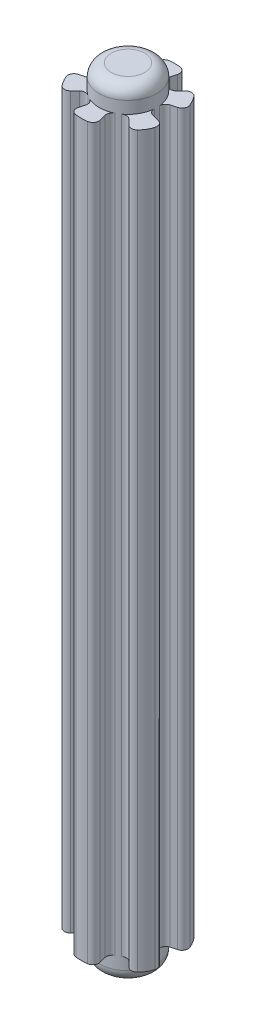
from build123d import *
from build123d.topology import SkipClean

# Parameters (mm, degrees)
BOSS_EXTRUDE1_DEPTH = 60
SKETCH4_R           = 2.375
BOSS_EXTRUDE3_DEPTH = 2
FILLET1_R           = 0.5
BOSS_EXTRUDE5_START = 2
SKETCH6_R           = 2.375
BOSS_EXTRUDE5_DEPTH = 2
FILLET2_R           = 1


with BuildPart() as part:
    # Sketch2 → Boss-Extrude1 (new body)
    with BuildSketch(Plane(origin=(0, 0, 0), x_dir=(1, 0, 0), z_dir=(0, 1, 0))):
        with BuildLine():
            Line((3.775215965, -0.978645895), (2.300774305, -0.58912019))
            ThreePointArc((2.300774305, -0.58912019), (2.374963211, 0.013219106), (2.294073837, 0.614695232))
            Line((2.294073837, 0.614695232), (3.742962577, 1.0029238))
            ThreePointArc((3.742962577, 1.0029238), (3.356294138, 1.936727823), (2.741299364, 2.73877761))
            Line((2.741299364, 2.73877761), (1.680151223, 1.678605632))
            ThreePointArc((1.680151223, 1.678605632), (1.187973207, 2.056537055), (0.614695232, 2.294073837))
            Line((0.614695232, 2.294073837), (1.0029238, 3.742962577))
            ThreePointArc((1.0029238, 3.742962577), (0, 3.875), (-1.0029238, 3.742962577))
            Line((-1.0029238, 3.742962577), (-0.614695232, 2.294073837))
            ThreePointArc((-0.614695232, 2.294073837), (-1.1875, 2.056810334), (-1.679378605, 1.679378605))
            Line((-1.679378605, 1.679378605), (-2.740038777, 2.740038777))
            ThreePointArc((-2.740038777, 2.740038777), (-3.35584844, 1.9375), (-3.742962577, 1.0029238))
            Line((-3.742962577, 1.0029238), (-2.294073837, 0.614695232))
            ThreePointArc((-2.294073837, 0.614695232), (-2.375, 0), (-2.294073837, -0.614695232))
            Line((-2.294073837, -0.614695232), (-3.742962577, -1.0029238))
            ThreePointArc((-3.742962577, -1.0029238), (-3.35584844, -1.9375), (-2.740038777, -2.740038777))
            Line((-2.740038777, -2.740038777), (-1.679378605, -1.679378605))
            ThreePointArc((-1.679378605, -1.679378605), (-1.1875, -2.056810334), (-0.614695232, -2.294073837))
            Line((-0.614695232, -2.294073837), (-1.0029238, -3.742962577))
            ThreePointArc((-1.0029238, -3.742962577), (0.033967076, -3.874851125), (1.068386506, -3.724805401))
            Line((1.068386506, -3.724805401), (0.681359786, -2.275164575))
            ThreePointArc((0.681359786, -2.275164575), (1.238849907, -2.026296106), (1.714477211, -1.643530618))
            Line((1.714477211, -1.643530618), (2.767163136, -2.698133353))
            ThreePointArc((2.767163136, -2.698133353), (3.500652231, -1.972912562), (3.775215965, -0.978645895))
        make_face()
        Polygon((0.085836926, -0.044584082), (0, 0), (0.073933818, 0), (0.104207494, -0.030328801), (0.080162685, -0.023330742), align=None, mode=Mode.SUBTRACT)
    extrude(amount=BOSS_EXTRUDE1_DEPTH)

    # Sketch4 → Boss-Extrude3 (add)
    with BuildSketch(Plane(origin=(0, 60, 0), x_dir=(1, 0, 0), z_dir=(0, 1, 0))):
        with Locations(Location((0, 0, 0), (0, 0, 75))):
            Circle(SKETCH4_R)
    extrude(amount=BOSS_EXTRUDE3_DEPTH)

    # Fillet1
    # the kernel refuses this fillet: 0.5 mm, written as the material it adds along each edge
    with BuildSketch(Plane(origin=(-2.294073837, 0, 0.614695232), x_dir=(-0.1735157400494046, 0, -0.9848310961556339), z_dir=(0, 1, 0)), Plane(origin=(-1.679378605, 0, -1.679378605), x_dir=(0.7661308776829403, 0, -0.6426845869170722), z_dir=(0, 1, 0)), Plane(origin=(0.614695232, 0, -2.294073837), x_dir=(0.939646617732385, 0, 0.3421465092384974), z_dir=(0, 1, 0)), Plane(origin=(2.294073837, 0, -0.614695232), x_dir=(0.1735157400495284, 0, 0.9848310961556122), z_dir=(0, 1, 0)), Plane(origin=(-0.614695232, 0, 2.294073837), x_dir=(-0.9396466177323688, 0, -0.3421465092385419), z_dir=(0, 1, 0))) as fillet1_piece_1:
        with BuildLine():
            CenterArc((0.458270974, 0.498091484), FILLET1_R, 185.007705084, 79.984589832)
            Line((-0.03982051, 0.45444663), (0, 0))
            ThreePointArc((0, 0), (0.20731306, 0.00906545), (0.414626119, 0))
        make_face()
    extrude(amount=60)
    with BuildSketch(Plane(origin=(-2.294073837, 0, -0.614695232), x_dir=(-0.17351574004940104, 0, 0.9848310961556345), z_dir=(0, 1, 0)), Plane(origin=(-0.614695232, 0, -2.294073837), x_dir=(-0.9396466177323672, 0, 0.3421465092385461), z_dir=(0, 1, 0)), Plane(origin=(1.680151223, 0, -1.678605632), x_dir=(-0.7658350540129166, 0, -0.643037067395833), z_dir=(0, 1, 0))) as fillet1_piece_2:
        with BuildLine():
            CenterArc((0.458270974, -0.498091484), FILLET1_R, 95.007705084, 79.984589832)
            Line((-0.03982051, -0.45444663), (0, 0))
            ThreePointArc((0, 0), (0.20731306, -0.00906545), (0.414626119, 0))
        make_face()
    extrude(amount=60)
    with BuildSketch(Plane(origin=(2.300774305, 0, 0.58912019), x_dir=(0.9668296370387235, 0, 0.2554221073900419), z_dir=(0, 1, 0))) as fillet1_piece_3:
        with BuildLine():
            CenterArc((0.453002414, 0.5), FILLET1_R, 190.38170854, 79.61829146)
            ThreePointArc((-0.038812111, 0.409897433), (-0.010506812, 0.205791362), (0, 0))
            Line((0, 0), (0.453002414, 0))
        make_face()
    extrude(amount=60)
    with BuildSketch(Plane(origin=(1.714477211, 0, 1.643530618), x_dir=(0.7064632978713469, 0, 0.7077496794494086), z_dir=(0, 1, 0))) as fillet1_piece_4:
        with BuildLine():
            CenterArc((0.465508471, -0.5), FILLET1_R, 90, 81.041880237)
            ThreePointArc((-0.02839274, -0.422143763), (-0.00477723, -0.211705398), (0, 0))
            Line((0, 0), (0.465508471, 0))
        make_face()
    extrude(amount=60)
    with BuildSketch(Plane(origin=(0.681359786, 0, 2.275164575), x_dir=(0.25794627414893684, 0, 0.966159262053975), z_dir=(0, 1, 0))) as fillet1_piece_5:
        with BuildLine():
            CenterArc((0.443713653, 0.5), FILLET1_R, 191.464392376, 78.535607624)
            ThreePointArc((-0.046310555, 0.400620549), (-0.014636445, 0.201295026), (0, 0))
            Line((0, 0), (0.443713653, 0))
        make_face()
    extrude(amount=60)
    with BuildSketch(Plane(origin=(-1.679378605, 0, 1.679378605), x_dir=(-0.7071067811865471, 0, 0.707106781186548), z_dir=(0, 1, 0))) as fillet1_piece_6:
        with BuildLine():
            CenterArc((0.456187913, 0.5), FILLET1_R, 190.015410168, 79.984589832)
            ThreePointArc((-0.036192593, 0.413043478), (-0.00906545, 0.20731306), (0, 0))
            Line((0, 0), (0.456187913, 0))
        make_face()
    extrude(amount=60)
    # the kernel refuses this fillet: 0.5 mm, written as the material it takes off along each edge
    with BuildSketch(Plane(origin=(-2.740038777, -1.439160897, 2.740038777), x_dir=(-0.6526300069150477, 0, -0.7576767609436524), z_dir=(0, 1, 0)), Plane(origin=(-3.742962577, -1.439160897, -1.0029238), x_dir=(0.3298523193767966, 0, -0.9440325457322686), z_dir=(0, 1, 0)), Plane(origin=(2.741299364, -1.439160897, -2.73877761), x_dir=(0.652281279601926, 0, 0.7579769998363237), z_dir=(0, 1, 0))) as fillet1_2_piece_1:
        with BuildLine():
            CenterArc((0.538524723, -0.49861874), FILLET1_R, 85.740187873, 98.519624254)
            Line((0.039905983, -0.535758376), (0, 0))
            ThreePointArc((0, 0), (0.287832179, 0.010704768), (0.575664359, 0))
        make_face()
    extrude(amount=62.878321794, mode=Mode.SUBTRACT)
    with BuildSketch(Plane(origin=(-3.742962577, -1.439160897, 1.0029238), x_dir=(0.9659258262890679, 0, -0.2588190451025218), z_dir=(0, 1, 0)), Plane(origin=(-2.740038777, -1.439160897, -2.740038777), x_dir=(0.7071067811865476, 0, 0.7071067811865476), z_dir=(0, 1, 0)), Plane(origin=(3.742962577, -1.439160897, -1.0029238), x_dir=(-0.9659258262890681, 0, 0.25881904510252185), z_dir=(0, 1, 0)), Plane(origin=(-1.0029238, -1.439160897, 3.742962577), x_dir=(0.2588190451025216, 0, -0.9659258262890681), z_dir=(0, 1, 0))) as fillet1_2_piece_2:
        with BuildLine():
            CenterArc((0.537242519, -0.5), FILLET1_R, 90, 98.519624254)
            ThreePointArc((0.04275993, -0.574074074), (0.010704768, -0.287832179), (0, 0))
            Line((0, 0), (0.537242519, 0))
        make_face()
    extrude(amount=62.878321794, mode=Mode.SUBTRACT)
    with BuildSketch(Plane(origin=(-1.0029238, -1.439160897, -3.742962577), x_dir=(0.25881904510252174, 0, 0.965925826289068), z_dir=(0, 1, 0))) as fillet1_2_piece_3:
        with BuildLine():
            CenterArc((0.537242519, 0.5), FILLET1_R, 171.480375746, 98.519624254)
            ThreePointArc((0.04275993, 0.574074074), (0.010704768, 0.287832179), (0, 0))
            Line((0, 0), (0.537242519, 0))
        make_face()
    extrude(amount=62.878321794, mode=Mode.SUBTRACT)
    with BuildSketch(Plane(origin=(1.0029238, -1.439160897, -3.742962577), x_dir=(-0.9824823262918377, 0, -0.1863557847886099), z_dir=(0, 1, 0))) as fillet1_2_piece_4:
        with BuildLine():
            CenterArc((0.538524723, 0.49861874), FILLET1_R, 175.740187873, 98.519624254)
            Line((0.039905983, 0.535758376), (0, 0))
            ThreePointArc((0, 0), (0.287832179, -0.010704768), (0.575664359, 0))
        make_face()
    extrude(amount=62.878321794, mode=Mode.SUBTRACT)
    with BuildSketch(Plane(origin=(3.775215965, -1.264396568, 0.978645895), x_dir=(-0.9668296370387236, 0, -0.25542210739004173), z_dir=(0, 1, 0))) as fillet1_2_piece_5:
        with BuildLine():
            CenterArc((0.437999819, 0.5), FILLET1_R, 179.77718135, 90.22281865)
            ThreePointArc((-0.0619964, 0.501944455), (-0.046928547, 0.249004631), (0, 0))
            Line((0, 0), (0.437999819, 0))
        make_face()
    extrude(amount=62.528793137, mode=Mode.SUBTRACT)
    with BuildSketch(Plane(origin=(2.767163136, -1.241563867, 2.698133353), x_dir=(0.8000663385432955, 0, -0.5999115384203949), z_dir=(0, 1, 0))) as fillet1_2_piece_6:
        with BuildLine():
            CenterArc((0.434547354, 0.496131331), FILLET1_R, 188.084320914, 89.047719887)
            Line((-0.060483736, 0.425816179), (0, 0))
            ThreePointArc((0, 0), (0.248312773, -0.015474675), (0.496625547, 0))
        make_face()
    extrude(amount=62.483127735, mode=Mode.SUBTRACT)
    with BuildSketch(Plane(origin=(1.068386506, -1.410819518, 3.724805401), x_dir=(-0.9787647804449897, 0, 0.20498659605074468), z_dir=(0, 1, 0))) as fillet1_2_piece_7:
        with BuildLine():
            CenterArc((0.527919562, -0.498672678), FILLET1_R, 85.824226653, 97.295295094)
            Line((0.028660468, -0.525882193), (0, 0))
            ThreePointArc((0, 0), (0.282163904, 0.010286747), (0.564327807, 0))
        make_face()
    extrude(amount=62.821639036, mode=Mode.SUBTRACT)

    # Sketch6 → Boss-Extrude5 (add)
    with SkipClean():  # the faces are left unmerged after this step: merging them gives an invalid solid
        with BuildSketch(Plane.XZ.offset(BOSS_EXTRUDE5_START)):
            with Locations(Location((0, 0, 0), (0, 0, 270))):
                Circle(SKETCH6_R)
        extrude(amount=-BOSS_EXTRUDE5_DEPTH)

    # Fillet2
    fillet2_edges = [part.edges().sort_by_distance(p)[0] for p in [
        (-0.614695232, 62, 2.294073837),
        (0, -2, 2.375),
    ]]
    fillet(fillet2_edges, radius=FILLET2_R)


solid = part.part
